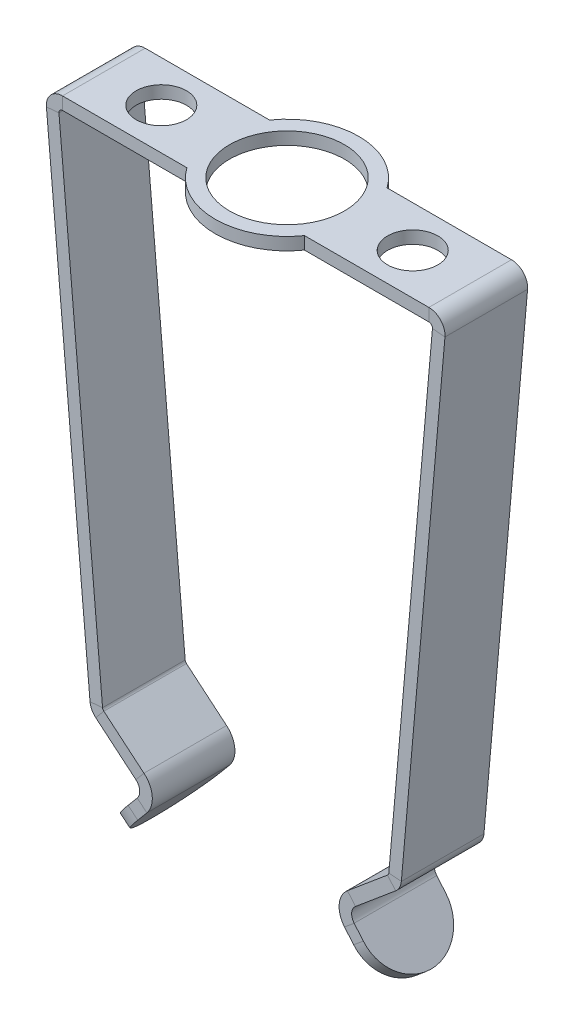
from build123d import *

# Parameters (mm, degrees)
BASE_FLANGE1_DEPTH             = 1.15
TAB1_DEPTH                     = 0.35
F_3_2_3_2_DIAMETER_HOLE1_D     = 3.2
F_1_4_1_4_DIAMETER_HOLE1_D     = 1.4
F_1_4_1_4_DIAMETER_HOLE1_DEPTH = 0.35
CUT_EXTRUDE1_DEPTH             = 10


# Sheet-metal steps are written as plain solids
with BuildPart() as part:
    # Sketch80 → Base-Flange1 (new, symmetric)
    with BuildSketch(Plane.XY):
        with BuildLine():
            Line((3.744076121, -16.948565679), (2.751685988, -15.763663573))
            ThreePointArc((2.751685988, -15.763663573), (2.602525969, -15.289062626), (2.832647456, -14.847997018))
            Line((2.832647456, -14.847997018), (3.949719342, -13.912416676))
            ThreePointArc((3.949719342, -13.912416676), (3.974169718, -13.88200963), (3.985122647, -13.844560429))
            Line((3.985122647, -13.844560429), (5.199611389, -0.108807447))
            ThreePointArc((5.199611389, -0.108807447), (5.17375888, -0.032474985), (5.1, 0))
            Line((5.1, 0), (-5.1, 0))
            ThreePointArc((-5.1, 0), (-5.17375888, -0.032474985), (-5.199611389, -0.108807447))
            Line((-5.199611389, -0.108807447), (-3.985122647, -13.844560429))
            ThreePointArc((-3.985122647, -13.844560429), (-3.974169718, -13.88200963), (-3.949719342, -13.912416676))
            Line((-3.949719342, -13.912416676), (-2.832647456, -14.847997018))
            ThreePointArc((-2.832647456, -14.847997018), (-2.602525969, -15.289062626), (-2.751685988, -15.763663573))
            Line((-2.751685988, -15.763663573), (-3.744076121, -16.948565679))
            Line((-3.744076121, -16.948565679), (-4.01239905, -16.723837386))
            Line((-4.01239905, -16.723837386), (-3.020008918, -15.53893528))
            ThreePointArc((-3.020008918, -15.53893528), (-2.951165832, -15.319888689), (-3.057375749, -15.116319947))
            Line((-3.057375749, -15.116319947), (-4.174447634, -14.180739606))
            ThreePointArc((-4.174447634, -14.180739606), (-4.284474328, -14.043907898), (-4.33376251, -13.875386492))
            Line((-4.33376251, -13.875386492), (-5.548251252, -0.13963351))
            ThreePointArc((-5.548251252, -0.13963351), (-5.431914959, 0.203862568), (-5.1, 0.35))
            Line((-5.1, 0.35), (5.1, 0.35))
            ThreePointArc((5.1, 0.35), (5.431914959, 0.203862568), (5.548251252, -0.13963351))
            Line((5.548251252, -0.13963351), (4.33376251, -13.875386492))
            ThreePointArc((4.33376251, -13.875386492), (4.284474328, -14.043907898), (4.174447634, -14.180739606))
            Line((4.174447634, -14.180739606), (3.057375749, -15.116319947))
            ThreePointArc((3.057375749, -15.116319947), (2.951165832, -15.319888689), (3.020008918, -15.53893528))
            Line((3.020008918, -15.53893528), (4.01239905, -16.723837386))
            Line((4.01239905, -16.723837386), (3.744076121, -16.948565679))
        make_face()
    extrude(amount=BASE_FLANGE1_DEPTH, both=True)

    # Sketch81 → Tab1 (add)
    with BuildSketch(Plane(origin=(0, 0.35, 0), x_dir=(1, 0, 0), z_dir=(0, 1, 0))):
        with BuildLine():
            Line((-1.636306817, 1.15), (1.636306817, 1.15))
            ThreePointArc((1.636306817, 1.15), (0, 2), (-1.636306817, 1.15))
        make_face()
        with BuildLine():
            Line((-1.636306817, -1.15), (1.636306817, -1.15))
            ThreePointArc((1.636306817, -1.15), (0, -2), (-1.636306817, -1.15))
        make_face()
    extrude(amount=-TAB1_DEPTH)

    # Ø3.2 (3.2) Diameter Hole1 (through all)
    with Locations(Plane(origin=(0, 0.35, 0), x_dir=(1, 0, 0), z_dir=(0, 1, 0))):
        with Locations((0, 0)):
            Hole(F_3_2_3_2_DIAMETER_HOLE1_D / 2)

    # Ø1.4 (1.4) Diameter Hole1
    with Locations(Plane(origin=(0, 0.35, 0), x_dir=(1, 0, 0), z_dir=(0, 1, 0))):
        with Locations((-3.5, 0), (3.5, 0)):
            Hole(F_1_4_1_4_DIAMETER_HOLE1_D / 2, depth=F_1_4_1_4_DIAMETER_HOLE1_DEPTH)

    # Sketch90 → Cut-Extrude1 (cut)
    with BuildSketch(Plane(origin=(-5.873973903, -4.919624761, 0), x_dir=(0, 0, -1), z_dir=(0.7666369409597348, 0.6420808366209819, 0))):
        with BuildLine():
            Line((-1.15, -15.897396074), (-1.15, -14.247396074))
            ThreePointArc((-1.15, -14.247396074), (0, -15.397396074), (1.15, -14.247396074))
            Line((1.15, -14.247396074), (1.15, -15.897396074))
            Line((1.15, -15.897396074), (-1.15, -15.897396074))
        make_face()
    cut_extrude1 = extrude(amount=-CUT_EXTRUDE1_DEPTH, mode=Mode.SUBTRACT)

    # Mirror1: Cut-Extrude1 across plane
    add(cut_extrude1.mirror(Plane(origin=(0, 0, 0), x_dir=(0, 0, 1), z_dir=(1, 0, 0))), mode=Mode.SUBTRACT)


solid = part.part
